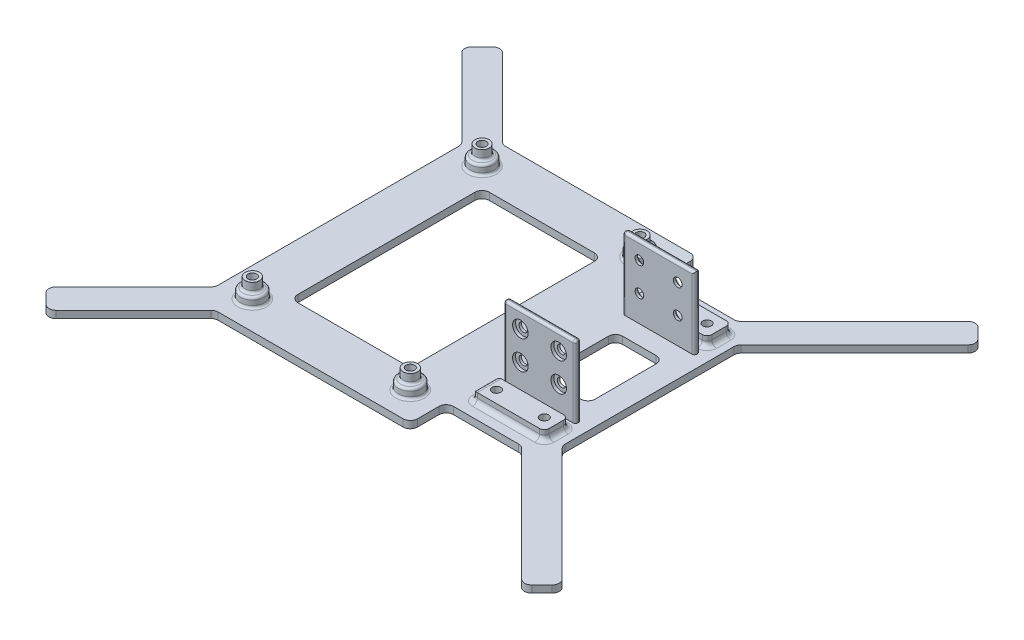
from build123d import *

# Parameters (mm, degrees)
BOSS_EXTRUDE1_DEPTH            = 3
SKETCH2_R                      = 5
BOSS_EXTRUDE2_DEPTH            = 4
SKETCH3_R                      = 3
BOSS_EXTRUDE3_DEPTH            = 4
FILLET1_R                      = 1
M3_CLEARANCE_HOLE1_D           = 3.6
CUT_EXTRUDE1_DEPTH             = 4
SKETCH9_W                      = 30
SKETCH9_H                      = 2.25
BOSS_EXTRUDE4_DEPTH            = 30
FILLET4_R                      = 1
CBORE_START                    = -35.25
CBORE_FOR_M3_SHCS1_OUTLINE_R   = 3.25
CBORE_FOR_M3_SHCS1_DEPTH       = 1.25
CBORE_START_2                  = -36.25
CBORE_FOR_M3_SHCS1_2_OUTLINE_R = 1.8
CBORE_FOR_M3_SHCS1_2_DEPTH     = 1
SKETCH12_W                     = 30
SKETCH12_H                     = 10
BOSS_EXTRUDE5_DEPTH            = 4
FILLET5_R                      = 2
M3_CLEARANCE_HOLE2_D           = 3.6
CUT_EXTRUDE2_DEPTH             = 4
SKETCH17_W                     = 50
SKETCH17_H                     = 80
SKETCH17_W_2                   = 20
SKETCH17_H_2                   = 31.5
CUT_EXTRUDE3_DEPTH             = 180.443584449
BOSS_EXTRUDE6_DEPTH            = 3
FILLET3_R                      = 3


# Read off the part's stored shape, not the designer's step: CBORE for M3 SHCS1
with BuildPart() as part:
    # Sketch1 → Boss-Extrude1 (new body)
    with BuildSketch(Plane(origin=(0, 0, 0), x_dir=(1, 0, 0), z_dir=(0, 1, 0))):
        Polygon((90, 105), (90, 120), (0, 120), (0, 0), (90, 0), (90, 15), (130, 15), (130, 105), align=None)
    extrude(amount=BOSS_EXTRUDE1_DEPTH)

    # Sketch2 → Boss-Extrude2 (add)
    with BuildSketch(Plane(origin=(0, 3, 0), x_dir=(1, 0, 0), z_dir=(0, 1, 0))):
        with Locations(Location((12, 108, 0), (0, 0, 90))):
            Circle(SKETCH2_R)
        with Locations(Location((78, 108, 0), (0, 0, 90))):
            Circle(SKETCH2_R)
        with Locations(Location((78, 12, 0), (0, 0, 90))):
            Circle(SKETCH2_R)
        with Locations(Location((12, 12, 0), (0, 0, 90))):
            Circle(SKETCH2_R)
    extrude(amount=BOSS_EXTRUDE2_DEPTH)

    # Sketch3 → Boss-Extrude3 (add)
    with BuildSketch(Plane(origin=(0, 7, 0), x_dir=(1, 0, 0), z_dir=(0, 1, 0))):
        with Locations(Location((12, 108, 0), (0, 0, 270))):
            Circle(SKETCH3_R)
        with Locations(Location((12, 12, 0), (0, 0, 270))):
            Circle(SKETCH3_R)
        with Locations(Location((78, 108, 0), (0, 0, 270))):
            Circle(SKETCH3_R)
        with Locations(Location((78, 12, 0), (0, 0, 270))):
            Circle(SKETCH3_R)
    extrude(amount=BOSS_EXTRUDE3_DEPTH)

    # Fillet1
    fillet1_edges = [part.edges().sort_by_distance(p)[0] for p in [
        (12, 3, -103),
        (12, 7, -103),
        (78, 3, -103),
        (78, 7, -103),
        (78, 3, -7),
        (78, 7, -7),
        (12, 3, -7),
        (12, 7, -7),
        (12, 7, -111),
        (12, 7, -15),
        (78, 7, -111),
        (78, 7, -15),
    ]]
    fillet(fillet1_edges, radius=FILLET1_R - 0.0001)  # a hair under: the kernel refuses the full size

    # M3 Clearance Hole1 (through all)
    with Locations(Plane(origin=(0, 11, 0), x_dir=(1, 0, 0), z_dir=(0, 1, 0))):
        with Locations((12, 12), (78, 12), (78, 108), (12, 108)):
            Hole(M3_CLEARANCE_HOLE1_D / 2)

    # Sketch8 → Cut-Extrude1 (cut)
    with BuildSketch(Plane(origin=(0, 0, 0), x_dir=(-1, 0, 0), z_dir=(0, -1, 0))):
        Polygon((-12, 8.420428331), (-8.9, 10.210214166), (-8.9, 13.789785834), (-12, 15.579571669), (-15.1, 13.789785834), (-15.1, 10.210214166), align=None)
        Polygon((-78, 15.579571669), (-81.1, 13.789785834), (-81.1, 10.210214166), (-78, 8.420428331), (-74.9, 10.210214166), (-74.9, 13.789785834), align=None)
        Polygon((-78, 111.579571669), (-81.1, 109.789785834), (-81.1, 106.210214166), (-78, 104.420428331), (-74.9, 106.210214166), (-74.9, 109.789785834), align=None)
        Polygon((-12, 111.579571669), (-15.1, 109.789785834), (-15.1, 106.210214166), (-12, 104.420428331), (-8.9, 106.210214166), (-8.9, 109.789785834), align=None)
    extrude(amount=-CUT_EXTRUDE1_DEPTH, mode=Mode.SUBTRACT)

    # Sketch9 → Boss-Extrude4 (add)
    with BuildSketch(Plane(origin=(0, 3, 0), x_dir=(1, 0, 0), z_dir=(0, 1, 0))):
        with Locations((110, 84.875)):
            Rectangle(SKETCH9_W, SKETCH9_H)
        with Locations((110, 35.125)):
            Rectangle(SKETCH9_W, SKETCH9_H)
    extrude(amount=BOSS_EXTRUDE4_DEPTH)

    # Fillet4
    fillet4_edges = [part.edges().sort_by_distance(p)[0] for p in [
        (125, 33, -35.125),
        (110, 33, -36.25),
        (110, 33, -34),
        (95, 33, -35.125),
        (95, 18, -34),
        (95, 18, -36.25),
        (125, 18, -34),
        (125, 18, -36.25),
        (125, 18, -86),
        (125, 18, -83.75),
        (110, 33, -86),
        (110, 33, -83.75),
        (95, 18, -86),
        (95, 18, -83.75),
        (95, 33, -84.875),
    ]]
    fillet(fillet4_edges, radius=FILLET4_R)

    # CBORE for M3 SHCS1 outline → CBORE for M3 SHCS1 (cut)
    with BuildSketch(Plane.XY.offset(CBORE_START)):
        with Locations((102, 14)):
            Circle(CBORE_FOR_M3_SHCS1_OUTLINE_R)
        with Locations((118, 14)):
            Circle(CBORE_FOR_M3_SHCS1_OUTLINE_R)
        with Locations((118, 26)):
            Circle(CBORE_FOR_M3_SHCS1_OUTLINE_R)
        with Locations((102, 26)):
            Circle(CBORE_FOR_M3_SHCS1_OUTLINE_R)
    cbore_for_m3_shcs1 = extrude(amount=CBORE_FOR_M3_SHCS1_DEPTH, mode=Mode.SUBTRACT)

    # CBORE for M3 SHCS1 2 outline → CBORE for M3 SHCS1 2 (cut)
    with BuildSketch(Plane.XY.offset(CBORE_START_2)):
        with Locations((102, 14)):
            Circle(CBORE_FOR_M3_SHCS1_2_OUTLINE_R)
        with Locations((118, 14)):
            Circle(CBORE_FOR_M3_SHCS1_2_OUTLINE_R)
        with Locations((118, 26)):
            Circle(CBORE_FOR_M3_SHCS1_2_OUTLINE_R)
        with Locations((102, 26)):
            Circle(CBORE_FOR_M3_SHCS1_2_OUTLINE_R)
    cbore_for_m3_shcs1_2 = extrude(amount=CBORE_FOR_M3_SHCS1_2_DEPTH, mode=Mode.SUBTRACT)

    # Mirror1: CBORE for M3 SHCS1, CBORE for M3 SHCS1 2 across plane
    add(cbore_for_m3_shcs1.mirror(Plane.XY.offset(-60)), mode=Mode.SUBTRACT)
    add(cbore_for_m3_shcs1_2.mirror(Plane.XY.offset(-60)), mode=Mode.SUBTRACT)

    # Sketch12 → Boss-Extrude5 (add)
    with BuildSketch(Plane(origin=(0, 3, 0), x_dir=(1, 0, 0), z_dir=(0, 1, 0))):
        with Locations((110, 26)):
            Rectangle(SKETCH12_W, SKETCH12_H)
        with Locations((110, 94)):
            Rectangle(SKETCH12_W, SKETCH12_H)
    extrude(amount=BOSS_EXTRUDE5_DEPTH)

    # Fillet5
    fillet5_edges = [part.edges().sort_by_distance(p)[0] for p in [
        (95, 3, -94),
        (110, 3, -99),
        (110, 3, -89),
        (110, 3, -31),
        (95, 5, -31),
        (95, 7, -26),
        (95, 5, -21),
        (95, 3, -26),
        (125, 5, -99),
        (95, 5, -99),
        (95, 5, -89),
        (125, 5, -89),
        (125, 3, -94),
        (125, 5, -31),
        (125, 5, -21),
        (125, 3, -26),
        (110, 3, -21),
    ]]
    fillet(fillet5_edges, radius=FILLET5_R - 0.0001)  # a hair under: the kernel refuses the full size

    # M3 Clearance Hole2 (through all)
    with Locations(Plane(origin=(0, 7, 0), x_dir=(1, 0, 0), z_dir=(0, 1, 0))):
        with Locations((120, 26), (100, 26)):
            m3_clearance_hole2 = Hole(M3_CLEARANCE_HOLE2_D / 2)

    # Sketch15 → Cut-Extrude2 (cut)
    with BuildSketch(Plane.XZ):
        Polygon((97.089426406, -23.916278645), (96.740157575, -27.478769994), (99.650731169, -29.56249135), (102.910573594, -28.083721355), (103.259842425, -24.521230006), (100.349268831, -22.43750865), align=None)
        Polygon((117.089426406, -23.916278645), (116.740157575, -27.478769994), (119.650731169, -29.56249135), (122.910573594, -28.083721355), (123.259842425, -24.521230006), (120.349268831, -22.43750865), align=None)
    cut_extrude2 = extrude(amount=-CUT_EXTRUDE2_DEPTH, mode=Mode.SUBTRACT)

    # Mirror2: M3 Clearance Hole2, Cut-Extrude2 across plane
    add(m3_clearance_hole2.mirror(Plane.XY.offset(-60)), mode=Mode.SUBTRACT)
    add(cut_extrude2.mirror(Plane.XY.offset(-60)), mode=Mode.SUBTRACT)

    # Sketch17 → Cut-Extrude3 (cut, through all)
    with BuildSketch(Plane(origin=(0, 3, 0), x_dir=(1, 0, 0), z_dir=(0, 1, 0))):
        with Locations((45, 60)):
            Rectangle(SKETCH17_W, SKETCH17_H)
        with Locations((110, 60)):
            Rectangle(SKETCH17_W_2, SKETCH17_H_2)
    extrude(amount=-CUT_EXTRUDE3_DEPTH, mode=Mode.SUBTRACT)

    # Sketch19 → Boss-Extrude6 (add)
    with BuildSketch(Plane(origin=(0, 3, 0), x_dir=(1, 0, 0), z_dir=(0, 1, 0))):
        Polygon((121.514718626, 15), (171.870057685, -35.355339059), (180.355339059, -26.870057685), (130, 23.485281374), align=None)
        Polygon((0, 8.485281374), (8.485281374, 0), (-26.870057685, -35.355339059), (-35.355339059, -26.870057685), align=None)
    boss_extrude6 = extrude(amount=-BOSS_EXTRUDE6_DEPTH)

    # Mirror3: Boss-Extrude6 across plane
    add(boss_extrude6.mirror(Plane(origin=(0, 0, -60), x_dir=(1, 0, 0), z_dir=(0, 0, -1))))

    # Fillet3
    fillet3_edges = [part.edges().sort_by_distance(p)[0] for p in [
        (90, 1.5, -120),
        (90, 1.5, -105),
        (90, 1.5, -15),
        (90, 1.5, 0),
        (20, 1.5, -20),
        (20, 1.5, -100),
        (70, 1.5, -100),
        (70, 1.5, -20),
        (100, 1.5, -44.25),
        (100, 1.5, -75.75),
        (120, 1.5, -75.75),
        (120, 1.5, -44.25),
        (121.514718626, 1.5, -15),
        (130, 1.5, -23.485281374),
        (180.355339059, 1.5, 26.870057685),
        (171.870057685, 1.5, 35.355339059),
        (-35.355339059, 1.5, 26.870057685),
        (0, 1.5, -8.485281374),
        (8.485281374, 1.5, 0),
        (-26.870057685, 1.5, 35.355339059),
        (130, 1.5, -96.514718626),
        (121.514718626, 1.5, -105),
        (171.870057685, 1.5, -155.355339059),
        (180.355339059, 1.5, -146.870057685),
        (0, 1.5, -111.514718626),
        (-35.355339059, 1.5, -146.870057685),
        (-26.870057685, 1.5, -155.355339059),
        (8.485281374, 1.5, -120),
    ]]
    fillet(fillet3_edges, radius=FILLET3_R)


solid = part.part
